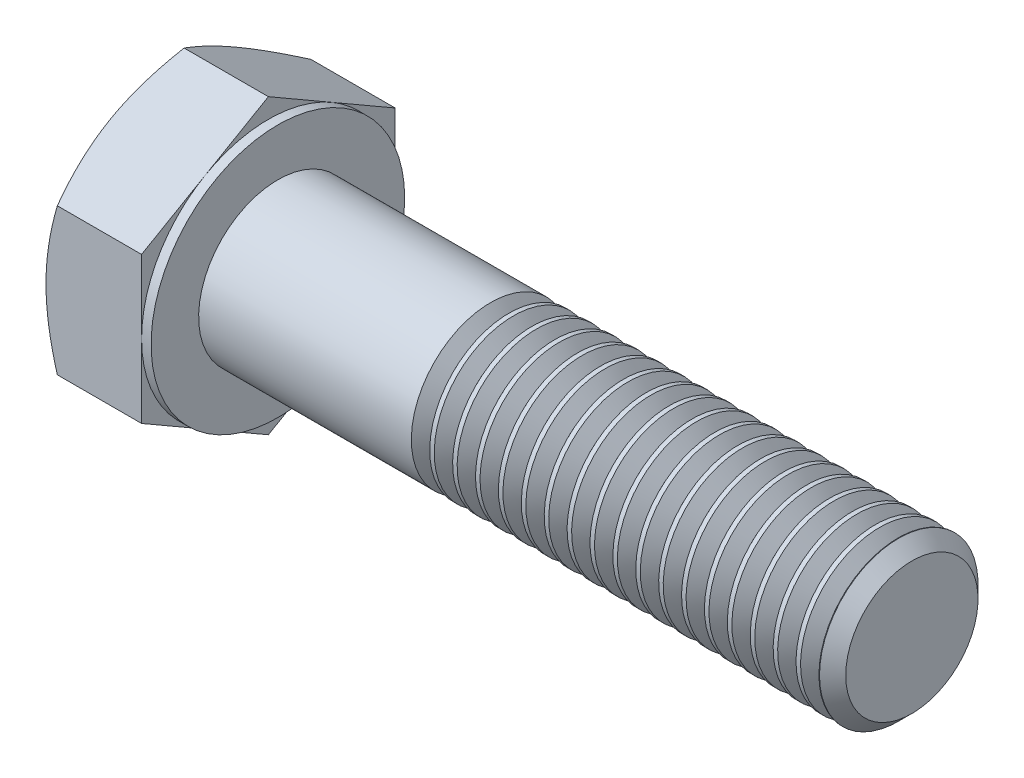
from build123d import *

# Parameters (mm, degrees)
BASEHEAD_DEPTH     = 6.63
INDENT_START       = -0.82875
INDENT_2_OUTLINE_R = 7
INDENT_2_DEPTH     = 0.82875
SKETCH4_W          = 0.6
SKETCH4_H          = 11.237604307
THDSCHPAT_COUNT    = 18
THDSCHPAT_PITCH    = 1.444444444


# Read off the part's stored shape, not the designer's step: Indent
with BuildPart() as part:
    # Sketch1 → BaseHead (new body)
    with BuildSketch(Plane(origin=(0, 0, 0), x_dir=(0, 0, -1), z_dir=(1, 0, 0))):
        Polygon((8, 4.618802154), (8, -4.618802154), (0, -9.237604307), (-8, -4.618802154), (-8, 4.618802154), (0, 9.237604307), align=None)
    extrude(amount=BASEHEAD_DEPTH)

    # Indent outline → Indent (revolve)
    with BuildSketch(Plane.YX):
        Polygon((5, 6.63), (5, 45.802), (4.172, 46.63), (0, 46.63), (0, 6.63), align=None)
    revolve(axis=Axis((0, 0, 0), (1, 0, 0)))

    # Indent 2 outline → Indent 2 (cut)
    with BuildSketch(Plane.ZY.offset(INDENT_START)):
        with Locations((0.033212245, 0.192376607)):
            Circle(INDENT_2_OUTLINE_R)
    extrude(amount=INDENT_2_DEPTH, mode=Mode.SUBTRACT)

    # Sketch3 → HeadChamfer (revolve, cut)
    with BuildSketch(Plane.XY, mode=Mode.PRIVATE) as headchamfer_sk:
        Polygon((0, 8), (3.601282526, 14.237604307), (3.601282526, 19.237604307), (-10, 19.237604307), (-10, 8), align=None)
    revolve(headchamfer_sk.sketch.rotate(Axis((0, 0, 0), (1, 0, 0)), 90), axis=Axis((0, 0, 0), (1, 0, 0)), mode=Mode.SUBTRACT)

    # Sketch4 → BearingFace (revolve, cut)
    with BuildSketch(Plane.XY, mode=Mode.PRIVATE) as bearingface_sk:
        with Locations((6.33, 13.618802154)):
            Rectangle(SKETCH4_W, SKETCH4_H)
    revolve(bearingface_sk.sketch.rotate(Axis((0, 0, 0), (1, 0, 0)), 90), axis=Axis((0, 0, 0), (1, 0, 0)), mode=Mode.SUBTRACT)

    # ThdSchSke → ThreadSchematic (revolve, cut)
    with BuildSketch(Plane.XY):
        Polygon((20.63, -4.172), (20.050228158, -5), (20.050228158, -6.25), (21.209771842, -6.25), (21.209771842, -5), align=None)
    threadschematic = revolve(axis=Axis((-3.175, 0, 0), (1, 0, 0)), mode=Mode.SUBTRACT)

    # ThdSchPat: ThreadSchematic ×18
    with Locations(*[(i * THDSCHPAT_PITCH, 0, 0) for i in range(1, THDSCHPAT_COUNT)]):
        add(threadschematic, mode=Mode.SUBTRACT)


solid = part.part
